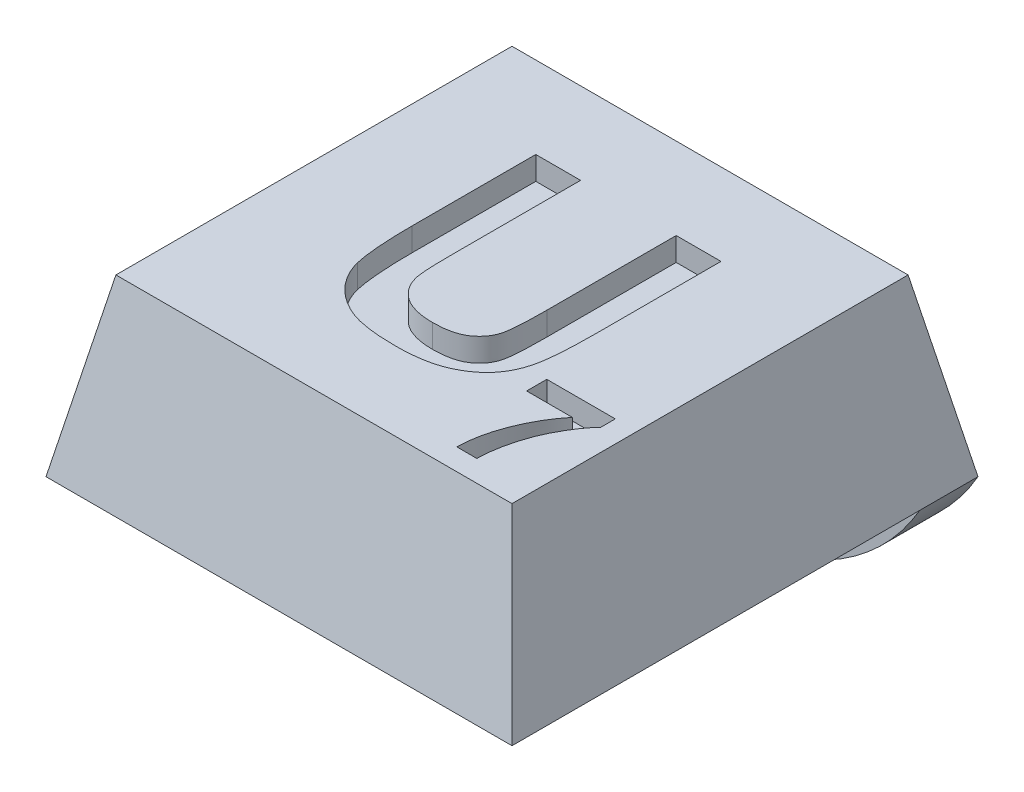
from build123d import *

# Parameters (mm, degrees)
SKETCH1_W               = 8
SKETCH1_H               = 8
BOSS_EXTRUDE1_DEPTH     = 3
CUT_EXTRUDE1_DEPTH      = 12.704699911
CUT_EXTRUDE1_DEPTH_BACK = 12.704699911
CUT_EXTRUDE2_DEPTH      = 11
SKETCH4_R               = 1.8
CUT_EXTRUDE3_DEPTH      = 0.8
SKETCH5_W               = 8
SKETCH5_H               = 1
BOSS_EXTRUDE2_DEPTH     = 2
FILLET1_R               = 4
CUT_EXTRUDE4_DEPTH      = 0.4
CUT_EXTRUDE5_DEPTH      = 0.4


with BuildPart() as part:
    # Sketch1 → Boss-Extrude1 (new body)
    with BuildSketch(Plane(origin=(0, 0, 0), x_dir=(1, 0, 0), z_dir=(0, 1, 0))):
        with Locations((4, 4)):
            Rectangle(SKETCH1_W, SKETCH1_H)
    extrude(amount=BOSS_EXTRUDE1_DEPTH)

    # Sketch2 → Cut-Extrude1 (cut, two sides: drawn at the far end of the back side and taken through both)
    with BuildSketch(Plane.XY.offset(-CUT_EXTRUDE1_DEPTH_BACK)):
        Polygon((0, 0), (0.6, 3), (0, 3), align=None)
        Polygon((8, 0), (7.4, 3), (8, 3), align=None)
    extrude(amount=CUT_EXTRUDE1_DEPTH + CUT_EXTRUDE1_DEPTH_BACK, mode=Mode.SUBTRACT)

    # Sketch3 → Cut-Extrude2 (cut)
    with BuildSketch(Plane(origin=(0, 0, 0), x_dir=(0, 0, -1), z_dir=(1, 0, 0))):
        Polygon((0, 0), (0.6, 3), (0, 3), align=None)
        Polygon((8, 3), (7.4, 3), (8, 0), align=None)
    extrude(amount=CUT_EXTRUDE2_DEPTH, mode=Mode.SUBTRACT)

    # Sketch4 → Cut-Extrude3 (cut)
    with BuildSketch(Plane.XZ):
        with Locations(Location((4, -3.75, 0), (0, 0, 270))):
            Circle(SKETCH4_R)
    extrude(amount=-CUT_EXTRUDE3_DEPTH, mode=Mode.SUBTRACT)

    # Sketch5 → Boss-Extrude2 (add)
    with BuildSketch(Plane.XZ):
        with Locations((4, -7.5)):
            Rectangle(SKETCH5_W, SKETCH5_H)
    extrude(amount=BOSS_EXTRUDE2_DEPTH)

    # Fillet1
    # the kernel refuses this fillet: 4 mm, written as the material it takes off along each edge
    with BuildSketch(Plane(origin=(8, -2, -16.660254038), x_dir=(0, 1, 0), z_dir=(0, 0, 1)), Plane(origin=(0, -2, 1.660254038), x_dir=(0, 1, 0), z_dir=(0, 0, -1))) as fillet1_piece_1:
        with BuildLine():
            CenterArc((4, 3.464101615), FILLET1_R, 180, 60)
            Line((0, 3.464101615), (-0.08, 3.464101615))
            Line((-0.08, 3.464101615), (-0.08, 0))
            Line((-0.08, 0), (0, -0.08))
            ThreePointArc((0, -0.08), (1, -0.08), (1.96, -0.069282032))
            Line((1.96, -0.069282032), (2, 0))
        make_face()
    extrude(amount=18.320508076, mode=Mode.SUBTRACT)

    # Sketch6 → Cut-Extrude4 (cut)
    with BuildSketch(Plane(origin=(0, 3, 0), x_dir=(1, 0, 0), z_dir=(0, 1, 0))):
        with BuildLine():
            Line((2.413140262, 5.995145478), (3.182371031, 5.995145478))
            Line((3.182371031, 5.995145478), (3.182371031, 3.824472401))
            add(Edge.make_bspline(
                [(3.182371031, 3.824472401), (3.182664695, 3.783339968), (3.183225327, 3.704814249), (3.183611242, 3.59262518), (3.18574694, 3.491896749), (3.190378411, 3.402466647), (3.193557117, 3.32438048), (3.199459629, 3.257623918), (3.205347836, 3.202222959), (3.211072588, 3.16927001), (3.213621031, 3.154600607)],
                knots=[0, 0, 0, 0, 1.470600056, 2.807515117, 4.011048972, 5.072079398, 6.00911328, 6.804506435, 7.467811572, 8, 8, 8, 8], degree=3))
            add(Edge.make_bspline(
                [(3.213621031, 3.154600607), (3.224127628, 3.115054038), (3.244816443, 3.03718185), (3.301842427, 2.930732637), (3.377172946, 2.83690436), (3.454012852, 2.769989694), (3.523520467, 2.722632459), (3.582561491, 2.693810163), (3.645203631, 2.667536787), (3.712771176, 2.647377448), (3.784538951, 2.629737301), (3.861373833, 2.619537644), (3.942627383, 2.611709661), (3.998321517, 2.610930314), (4.026922313, 2.610530094)],
                knots=[0, 0, 0, 0, 1.376921055, 2.711331395, 4.038631339, 5.418057255, 6.132954575, 6.870556231, 7.630397752, 8.422890386, 9.247036838, 10.121396817, 11.035274583, 12, 12, 12, 12], degree=3))
            add(Edge.make_bspline(
                [(4.026922313, 2.610530094), (4.055777389, 2.611053435), (4.111957634, 2.612072369), (4.193372399, 2.618140476), (4.269330983, 2.629588903), (4.339786919, 2.644600001), (4.40511233, 2.663571514), (4.464786061, 2.687591678), (4.518714075, 2.716497769), (4.582078678, 2.760066391), (4.650258908, 2.821527538), (4.715873674, 2.905091818), (4.762833649, 2.997337694), (4.784859868, 3.081565077), (4.796180605, 3.154949811), (4.803077806, 3.219164001), (4.809385646, 3.291832182), (4.815113647, 3.372755319), (4.819030865, 3.461994153), (4.821149619, 3.559774375), (4.82281709, 3.666080391), (4.823198873, 3.739802878), (4.823396672, 3.777998042)],
                knots=[0, 0, 0, 0, 1.036876239, 2.018776863, 2.930845756, 3.794842666, 4.605604932, 5.371924355, 6.101864688, 6.799283669, 8.1310906, 9.382718023, 10.597336334, 11.822035891, 12.492591141, 13.265194674, 14.141890321, 15.11351293, 16.179860579, 17.351049011, 18.627594861, 20, 20, 20, 20], degree=3))
            Line((4.823396672, 3.777998042), (4.823396672, 5.995145478))
            Line((4.823396672, 5.995145478), (5.592627441, 5.995145478))
            Line((5.592627441, 5.995145478), (5.592627441, 3.902998042))
            add(Edge.make_bspline(
                [(5.592627441, 3.902998042), (5.592528847, 3.845305157), (5.592339402, 3.734449864), (5.589381475, 3.574956755), (5.583094941, 3.428628514), (5.577830511, 3.295214312), (5.567675642, 3.175054503), (5.557043529, 3.068074376), (5.543346947, 2.974292627), (5.523815493, 2.867696041), (5.490991615, 2.748101531), (5.438090809, 2.615994056), (5.370481989, 2.495804532), (5.288434562, 2.387071806), (5.192421188, 2.289363714), (5.081004269, 2.203064381), (4.955329501, 2.127124651), (4.84016309, 2.072443299), (4.739752735, 2.035622669), (4.65797018, 2.010704116), (4.570444093, 1.989952175), (4.477277128, 1.973483664), (4.378429252, 1.959598273), (4.273864574, 1.950325107), (4.163741291, 1.944537997), (4.088628699, 1.944091898), (4.050159493, 1.943863427)],
                knots=[0, 0, 0, 0, 1.415574045, 2.719986624, 3.913607924, 5.00929969, 5.995467356, 6.871900228, 7.64671288, 8.320227872, 9.530145585, 10.682614022, 11.803571353, 12.90325401, 14.015460715, 15.154679255, 16.351678057, 17.612271512, 18.275764165, 18.974412946, 19.708786676, 20.481351116, 21.295095879, 22.157200529, 23.056203067, 24, 24, 24, 24], degree=3))
            add(Edge.make_bspline(
                [(4.050159493, 1.943863427), (4.00394899, 1.944454117), (3.914432357, 1.945598373), (3.784491522, 1.950702797), (3.663419731, 1.961238523), (3.550836598, 1.975478544), (3.446788608, 1.993784557), (3.351012543, 2.015669281), (3.264273035, 2.043328483), (3.160959321, 2.082832512), (3.045798952, 2.143260432), (2.920442018, 2.223870786), (2.810400187, 2.314853884), (2.716640343, 2.415320705), (2.638260762, 2.521740618), (2.574552012, 2.631810814), (2.523497916, 2.743696672), (2.502164616, 2.821459533), (2.491665903, 2.859728812)],
                knots=[0, 0, 0, 0, 1.128613534, 2.186292659, 3.174878439, 4.095586888, 4.95671962, 5.754129884, 6.492676435, 7.178284149, 8.453103036, 9.659838108, 10.813193309, 11.929983019, 13.007587775, 14.033493319, 15.032227051, 16, 16, 16, 16], degree=3))
            add(Edge.make_bspline(
                [(2.491665903, 2.859728812), (2.48524032, 2.889857793), (2.471705989, 2.953319061), (2.456334745, 3.054210037), (2.442311642, 3.165307899), (2.432733679, 3.286744058), (2.423654648, 3.418133217), (2.417136225, 3.559723113), (2.414455843, 3.711481594), (2.413587623, 3.816192051), (2.413140262, 3.870145478)],
                knots=[0, 0, 0, 0, 0.728071598, 1.533551606, 2.411422299, 3.374601532, 4.412367648, 5.524718474, 6.72457895, 8, 8, 8, 8], degree=3))
            Line((2.413140262, 3.870145478), (2.413140262, 5.995145478))
        make_face()
    extrude(amount=-CUT_EXTRUDE4_DEPTH, mode=Mode.SUBTRACT)

    # Sketch7 → Cut-Extrude5 (cut)
    with BuildSketch(Plane(origin=(0, 3, 0), x_dir=(1, 0, 0), z_dir=(0, 1, 0))):
        with BuildLine():
            Line((5.850386773, 2.400368579), (5.850386773, 2.746522425))
            Line((5.850386773, 2.746522425), (7.02730985, 2.746522425))
            Line((7.02730985, 2.746522425), (7.02730985, 2.492676271))
            add(Edge.make_bspline(
                [(7.02730985, 2.492676271), (7.015032321, 2.480184286), (6.989793248, 2.454504354), (6.953640746, 2.41247659), (6.916952595, 2.366869092), (6.880495981, 2.317067299), (6.84313767, 2.263857918), (6.806519427, 2.206220957), (6.769380335, 2.144904141), (6.719379376, 2.058171383), (6.660934493, 1.944871602), (6.599102899, 1.804034186), (6.546425212, 1.658871525), (6.510353845, 1.535182236), (6.485981829, 1.436045461), (6.470058334, 1.363554301), (6.45665413, 1.293103137), (6.44574982, 1.224568153), (6.437611625, 1.157918082), (6.431181064, 1.093384645), (6.428008496, 1.030810475), (6.427540351, 0.989794441), (6.42730985, 0.969599348)],
                knots=[0, 0, 0, 0, 0.628545797, 1.29210959, 1.98878689, 2.729126096, 3.507039704, 4.322017351, 5.179550397, 6.080149501, 7.915136253, 9.752312618, 11.597470118, 13.454141581, 14.373891568, 15.261584755, 16.117868869, 16.947726723, 17.752002974, 18.527724242, 19.275094557, 20, 20, 20, 20], degree=3))
            Line((6.42730985, 0.969599348), (6.081156004, 0.969599348))
            add(Edge.make_bspline(
                [(6.081156004, 0.969599348), (6.082313464, 1.000264514), (6.084641243, 1.061935513), (6.093350513, 1.15450167), (6.107029358, 1.247412503), (6.124019401, 1.340882746), (6.146450494, 1.434684851), (6.172051243, 1.529166286), (6.203062702, 1.623822431), (6.237825714, 1.718472296), (6.276202253, 1.812217257), (6.31802728, 1.903894573), (6.363192674, 1.992932291), (6.411111069, 2.079643245), (6.462339924, 2.16374848), (6.516917811, 2.245156666), (6.574070556, 2.324456683), (6.614935451, 2.375068877), (6.635362734, 2.400368579)],
                knots=[0, 0, 0, 0, 0.943249748, 1.896978291, 2.856365892, 3.829648507, 4.816416106, 5.820376826, 6.838120354, 7.877341886, 8.919613352, 9.951365796, 10.974227495, 11.988073359, 12.996274698, 14.000568529, 15.000536908, 16, 16, 16, 16], degree=3))
            Line((6.635362734, 2.400368579), (5.850386773, 2.400368579))
        make_face()
    extrude(amount=-CUT_EXTRUDE5_DEPTH, mode=Mode.SUBTRACT)


solid = part.part
